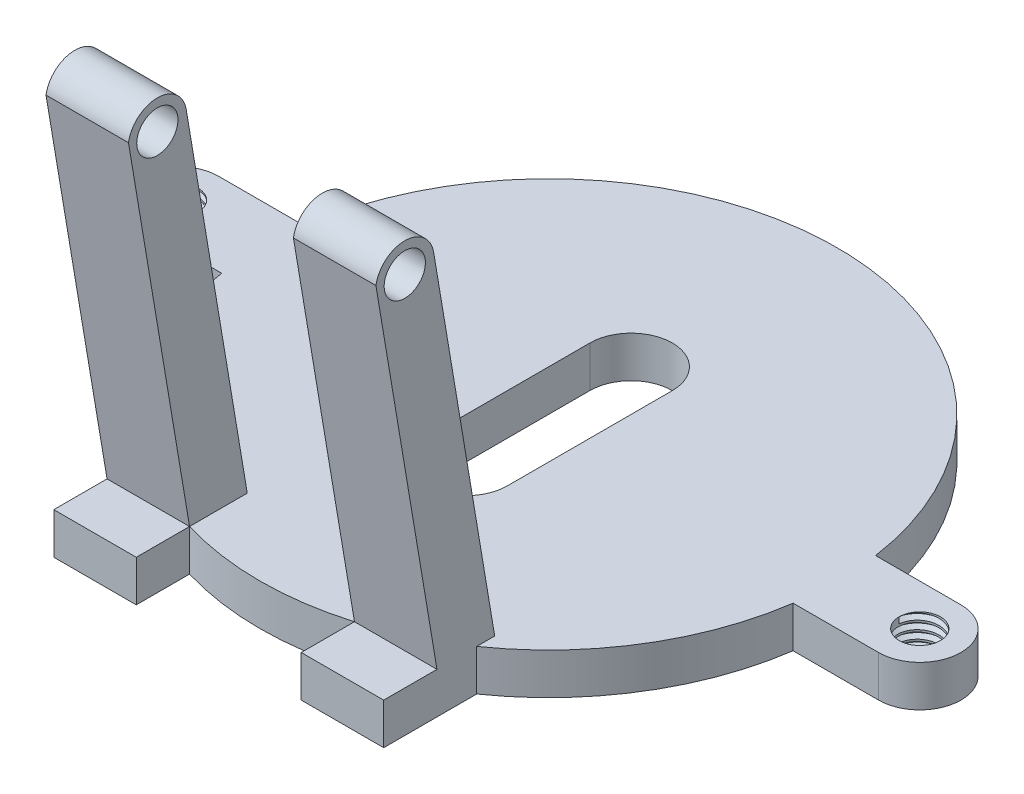
from build123d import *

# Parameters (mm, degrees)
SKETCH1_R           = 44.45
BOSS_EXTRUDE1_DEPTH = 6.35
SKETCH2_R           = 3.175
BOSS_EXTRUDE2_DEPTH = 6.35
THREAD2_PITCH       = 1.27
BOSS_EXTRUDE3_DEPTH = 6.35
SKETCH9_R           = 3.175
BOSS_EXTRUDE4_DEPTH = 12.7
CUT_EXTRUDE1_DEPTH  = 6.35


with BuildPart() as part:
    # Sketch1 → Boss-Extrude1 (new body)
    with BuildSketch(Plane(origin=(0, 0, 0), x_dir=(1, 0, 0), z_dir=(0, 1, 0))):
        with Locations(Location((0, 0, 0), (0, 0, 270))):
            Circle(SKETCH1_R)
    extrude(amount=BOSS_EXTRUDE1_DEPTH)

    # Sketch2 → Boss-Extrude2 (add)
    with BuildSketch(Plane(origin=(0, 6.35, 0), x_dir=(1, 0, 0), z_dir=(0, 1, 0))):
        with BuildLine():
            Line((42.672, 0), (42.672, 6.35))
            Line((42.672, 6.35), (57.15, 6.35))
            ThreePointArc((57.15, 6.35), (63.5, 0), (57.15, -6.35))
            Line((57.15, -6.35), (42.672, -6.35))
            Line((42.672, -6.35), (42.672, 0))
        make_face()
        with Locations(Location((57.15, 0, 0), (0, 0, 270))):
            Circle(SKETCH2_R, mode=Mode.SUBTRACT)
    boss_extrude2 = extrude(amount=-BOSS_EXTRUDE2_DEPTH)

    # Thread2: the profile of Thread Profile2 profile screwed along a right-hand helix of 7.874016 turns, 8 arcs to a turn; built about Z, then put on its axis
    thread2_z = Axis((0, 0, 0), (0, 0, 1))
    thread2_corners = [(3.1747, 0, -0.000173205), (3.862407661, 0, 0.396874998), (3.862407661, 0, 0.555624998), (3.1747, 0, 0.952673202)]
    with BuildLine(mode=Mode.PRIVATE) as thread2_profile:
        Line(thread2_corners[0], thread2_corners[1])
        Line(thread2_corners[1], thread2_corners[2])
        Line(thread2_corners[2], thread2_corners[3])
        Line(thread2_corners[3], thread2_corners[0])
    thread2_cap = Face(thread2_profile.wire())
    thread2_turn_angles = [0, 22.5, 45, 67.5, 90, 112.5, 135, 157.5, 180, 202.5, 225, 247.5, 270, 292.5, 315, 337.5, 360]
    thread2_turn_weights = [1, 0.9238795325112867, 1, 0.9238795325112867, 1, 0.9238795325112867, 1, 0.9238795325112867, 1, 0.9238795325112867, 1, 0.9238795325112867, 1, 0.9238795325112867, 1, 0.9238795325112867, 1]
    thread2_turn_rails = [Edge.make_bspline([Vector(p[0], p[1], 0).rotate(thread2_z, thread2_turn_angles[k]) / thread2_turn_weights[k] + Vector(0, 0, p[2] + THREAD2_PITCH * thread2_turn_angles[k] / 360) for k in range(17)], [0, 0, 0, 1, 1, 2, 2, 3, 3, 4, 4, 5, 5, 6, 6, 7, 7, 8, 8, 8], 2, thread2_turn_weights) for p in thread2_corners]
    thread2_turn_sides = [Face.make_surface_from_curves(thread2_turn_rails[p[0]], thread2_turn_rails[p[1]]) for p in [(0, 1), (1, 2), (2, 3), (3, 0)]]
    thread2_last_angles = [2520, 2542.5, 2565, 2587.5, 2610, 2632.5, 2655, 2677.5, 2700, 2722.5, 2745, 2767.5, 2790, 2812.322834646, 2834.645669291]
    thread2_last_weights = [1, 0.9238795325112867, 1, 0.9238795325112867, 1, 0.9238795325112867, 1, 0.9238795325112867, 1, 0.9238795325112867, 1, 0.9238795325112867, 1, 0.9250584165493104, 1]
    thread2_last_rails = [Edge.make_bspline([Vector(p[0], p[1], 0).rotate(thread2_z, thread2_last_angles[k]) / thread2_last_weights[k] + Vector(0, 0, p[2] + THREAD2_PITCH * thread2_last_angles[k] / 360) for k in range(15)], [0, 0, 0, 1, 1, 2, 2, 3, 3, 4, 4, 5, 5, 6, 6, 7, 7, 7], 2, thread2_last_weights) for p in thread2_corners]
    thread2_last_sides = [Face.make_surface_from_curves(thread2_last_rails[p[0]], thread2_last_rails[p[1]]) for p in [(0, 1), (1, 2), (2, 3), (3, 0)]]
    thread2 = Plane(origin=(57.15, 6.35, 0), x_dir=(-1, 0, 0), z_dir=(0, -1, 0)) * Solid(Shell([*[p.moved(Location((0, 0, THREAD2_PITCH * i))) for i in range(7) for p in thread2_turn_sides], *thread2_last_sides, thread2_cap, thread2_cap.rotate(thread2_z, 2834.645669291).moved(Location((0, 0, THREAD2_PITCH * 2834.645669291 / 360)))]))
    add(thread2, mode=Mode.SUBTRACT)

    # Mirror1: Boss-Extrude2, Thread2 across plane
    add(boss_extrude2.mirror(Plane(origin=(0, 0, 0), x_dir=(0, 0, 1), z_dir=(1, 0, 0))))
    add(thread2.mirror(Plane(origin=(0, 0, 0), x_dir=(0, 0, 1), z_dir=(1, 0, 0))), mode=Mode.SUBTRACT)

    # Sketch7 → Boss-Extrude3 (add)
    with BuildSketch(Plane(origin=(0, 0, 0), x_dir=(1, 0, 0), z_dir=(0, 1, 0))):
        Polygon((-25.4, -25.4), (-25.4, -50.8), (-12.7, -50.8), (-12.7, -38.1), (12.7, -38.1), (12.7, -50.8), (25.4, -50.8), (25.4, -25.4), align=None)
    extrude(amount=BOSS_EXTRUDE3_DEPTH)

    # Sweep1: sweep along a curve in space
    with BuildLine() as sweep1_path:
        Line((-19.05, 6.35, 38.152094971), (-19.05, 57.15, 46.698547486))
    # 3DSketch2 → Sweep1 (sweep)
    with BuildSketch(Plane(origin=(-12.7, 6.35, 42.597094971), x_dir=(-0.8192319205190405, 0, -0.5734623443633283), z_dir=(0, -1, 0))):
        Polygon((0, 0), (5.098080241, 7.282971773), (15.502325632, 0), (10.404245391, -7.282971773), align=None)
    sweep1 = sweep(path=sweep1_path.line)

    # Sketch9 → Boss-Extrude4 (add)
    with BuildSketch(Plane.ZY.offset(25.4)):
        with BuildLine():
            Line((42.253547486, 57.15), (51.143547486, 57.15))
            Line((51.143547486, 57.15), (51.998192737, 62.23))
            ThreePointArc((51.998192737, 62.23), (47.553192737, 65.989651619), (43.108192737, 62.23))
            Line((43.108192737, 62.23), (42.253547486, 57.15))
        make_face()
        with Locations((47.553192737, 61.482185405)):
            Circle(SKETCH9_R, mode=Mode.SUBTRACT)
    boss_extrude4 = extrude(amount=-BOSS_EXTRUDE4_DEPTH)

    # Mirror2: Sweep1, Boss-Extrude4 across plane
    add(sweep1.mirror(Plane(origin=(0, 0, 0), x_dir=(0, 0, 1), z_dir=(1, 0, 0))))
    add(boss_extrude4.mirror(Plane(origin=(0, 0, 0), x_dir=(0, 0, 1), z_dir=(1, 0, 0))))

    # Sketch10 → Cut-Extrude1 (cut)
    with BuildSketch(Plane(origin=(0, 6.35, 0), x_dir=(1, 0, 0), z_dir=(0, 1, 0))):
        with BuildLine():
            Line((6.35, 12.7), (6.35, -12.7))
            ThreePointArc((6.35, -12.7), (0, -19.05), (-6.35, -12.7))
            Line((-6.35, -12.7), (-6.35, 12.7))
            ThreePointArc((-6.35, 12.7), (0, 19.05), (6.35, 12.7))
        make_face()
    extrude(amount=-CUT_EXTRUDE1_DEPTH, mode=Mode.SUBTRACT)


solid = part.part
